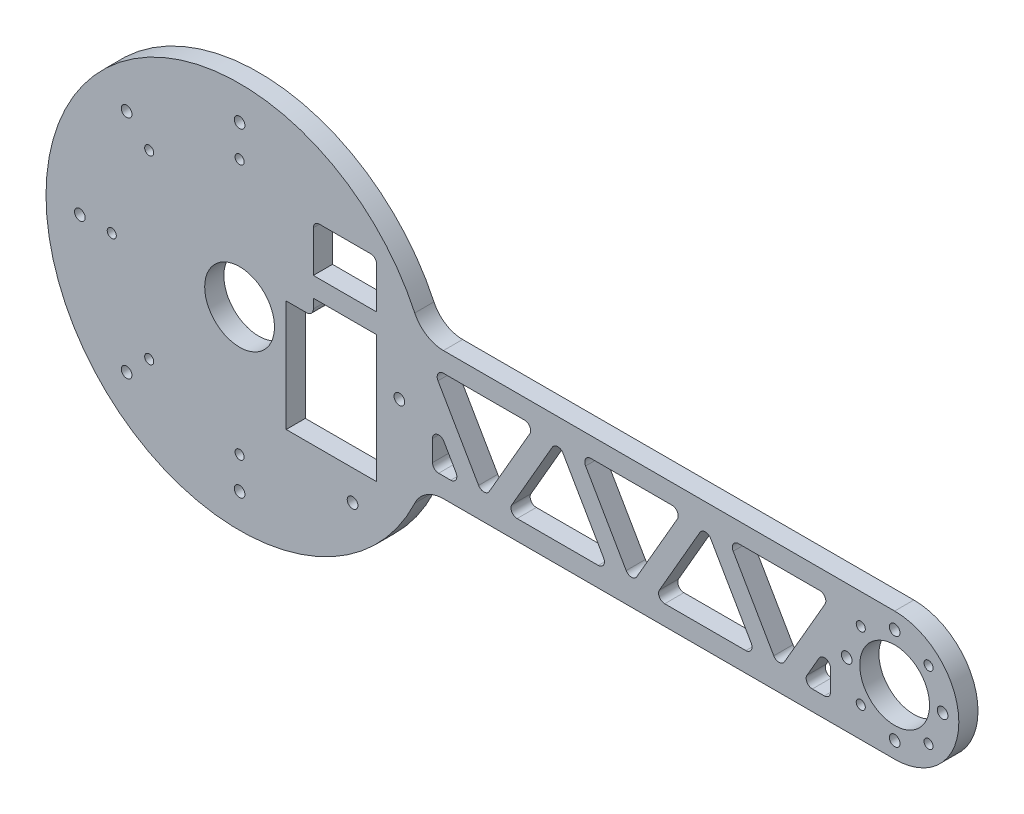
from build123d import *

# Parameters (mm, degrees)
SKETCH1_R              = 11
SKETCH1_R_2            = 1.75
SKETCH1_R_3            = 1.5
BOSS_EXTRUDE1_DEPTH    = 6
SKETCH2_W              = 20
SKETCH2_H              = 15
CUT_EXTRUDE1_DEPTH     = 234.069195734
FILLET1_R              = 2
FILLET2_R              = 10
CUT_EXTRUDE2_DEPTH     = 234.069195734
FILLET3_R              = 2
MOVE_FACE1_OUTLINE_R   = 11
MOVE_FACE1_OUTLINE_R_2 = 10.92
MOVE_FACE1_OUTLINE_R_3 = 1.75
MOVE_FACE1_OUTLINE_R_4 = 1.67
MOVE_FACE1_OUTLINE_R_5 = 1.5
MOVE_FACE1_OUTLINE_R_6 = 1.42
MOVE_FACE1_DEPTH       = 6


# Read off the part's stored shape, not the designer's step: Move Face1
with BuildPart() as part:
    # Sketch1 → Boss-Extrude1 (new body)
    with BuildSketch(Plane.XY):
        with BuildLine():
            Line((57.098598932, -20), (205, -20))
            ThreePointArc((205, -20), (225, 0), (205, 20))
            Line((205, 20), (57.098598932, 20))
            ThreePointArc((57.098598932, 20), (-60.5, 0), (57.098598932, -20))
        make_face()
        Circle(SKETCH1_R, mode=Mode.SUBTRACT)
        with Locations((205, 0)):
            Circle(SKETCH1_R, mode=Mode.SUBTRACT)
        with Locations((205, -15)):
            Circle(SKETCH1_R_2, mode=Mode.SUBTRACT)
        with Locations((215.606601718, -10.606601718)):
            Circle(SKETCH1_R_3, mode=Mode.SUBTRACT)
        with Locations((190, 0)):
            Circle(SKETCH1_R_2, mode=Mode.SUBTRACT)
        with Locations((194.393398282, -10.606601718)):
            Circle(SKETCH1_R_3, mode=Mode.SUBTRACT)
        with Locations((205, 15)):
            Circle(SKETCH1_R_2, mode=Mode.SUBTRACT)
        with Locations((194.393398282, 10.606601718)):
            Circle(SKETCH1_R_3, mode=Mode.SUBTRACT)
        with Locations((220, 0)):
            Circle(SKETCH1_R_2, mode=Mode.SUBTRACT)
        with Locations((215.606601718, 10.606601718)):
            Circle(SKETCH1_R_3, mode=Mode.SUBTRACT)
        with Locations((0, -40)):
            Circle(SKETCH1_R_3, mode=Mode.SUBTRACT)
        with Locations((0, -50)):
            Circle(SKETCH1_R_2, mode=Mode.SUBTRACT)
        with Locations((-28.284271247, -28.284271247)):
            Circle(SKETCH1_R_3, mode=Mode.SUBTRACT)
        with Locations((-35.355339059, -35.355339059)):
            Circle(SKETCH1_R_2, mode=Mode.SUBTRACT)
        with Locations((-40, 0)):
            Circle(SKETCH1_R_3, mode=Mode.SUBTRACT)
        with Locations((-50, 0)):
            Circle(SKETCH1_R_2, mode=Mode.SUBTRACT)
        with Locations((-28.284271247, 28.284271247)):
            Circle(SKETCH1_R_3, mode=Mode.SUBTRACT)
        with Locations((-35.355339059, 35.355339059)):
            Circle(SKETCH1_R_2, mode=Mode.SUBTRACT)
        with Locations((0, 40)):
            Circle(SKETCH1_R_3, mode=Mode.SUBTRACT)
        with Locations((0, 50)):
            Circle(SKETCH1_R_2, mode=Mode.SUBTRACT)
        with Locations((50, 0)):
            Circle(SKETCH1_R_2, mode=Mode.SUBTRACT)
        with Locations((35.355339059, -35.355339059)):
            Circle(SKETCH1_R_2, mode=Mode.SUBTRACT)
    extrude(amount=BOSS_EXTRUDE1_DEPTH)

    # Sketch2 → Cut-Extrude1 (cut, through all)
    with BuildSketch(Plane.XY.offset(6)):
        Polygon((23, 14), (43, 14), (43, -26), (14.5, -26), (14.5, 9), (23, 9), align=None)
        with Locations((33, 27.5)):
            Rectangle(SKETCH2_W, SKETCH2_H)
    extrude(amount=-CUT_EXTRUDE1_DEPTH, mode=Mode.SUBTRACT)

    # Fillet1
    fillet1_edges = [part.edges().sort_by_distance(p)[0] for p in [
        (23, 35, 3),
        (43, 35, 3),
        (23, 9, 3),
    ]]
    fillet(fillet1_edges, radius=FILLET1_R)

    # Fillet2
    fillet2_edges = [part.edges().sort_by_distance(p)[0] for p in [
        (57.098598932, 20, 3),
        (57.098598932, -20, 3),
    ]]
    fillet(fillet2_edges, radius=FILLET2_R)

    # Sketch3 → Cut-Extrude2 (cut, through all)
    with BuildSketch(Plane.XY.offset(6)):
        Polygon((60.292341855, 14), (92.62395693, 14), (76.458149392, -14), align=None)
        Polygon((83.386352623, -14), (99.55216016, 14), (115.717967697, -14), align=None)
        Polygon((106.48036339, 14), (122.646170928, -14), (138.811978465, 14), align=None)
        Polygon((129.574374158, -14), (145.740181695, 14), (161.905989232, -14), align=None)
        Polygon((152.668384925, 14), (168.834192463, -14), (185, 14), align=None)
        Polygon((60.292341855, 2), (60.292341855, -14), (69.529946162, -14), align=None)
        Polygon((185, 2), (185, -14), (175.762395693, -14), align=None)
    extrude(amount=-CUT_EXTRUDE2_DEPTH, mode=Mode.SUBTRACT)

    # Fillet3
    fillet3_edges = [part.edges().sort_by_distance(p)[0] for p in [
        (76.458149392, -14, 3),
        (60.292341855, 14, 3),
        (92.62395693, 14, 3),
        (115.717967697, -14, 3),
        (83.386352623, -14, 3),
        (99.55216016, 14, 3),
        (106.48036339, 14, 3),
        (138.811978465, 14, 3),
        (122.646170928, -14, 3),
        (161.905989232, -14, 3),
        (129.574374158, -14, 3),
        (145.740181695, 14, 3),
        (152.668384925, 14, 3),
        (185, 14, 3),
        (168.834192463, -14, 3),
        (60.292341855, 2, 3),
        (69.529946162, -14, 3),
        (60.292341855, -14, 3),
        (175.762395693, -14, 3),
        (185, 2, 3),
        (185, -14, 3),
    ]]
    fillet(fillet3_edges, radius=FILLET3_R)

    # Move Face1 outline → Move Face1 (add)
    # profile 1 of 32: a face of its own
    with BuildSketch(Plane.XY):
        with BuildLine():
            ThreePointArc((54.82147225, 25.778723404), (-60.58, 0), (54.82147225, -25.778723404))
            ThreePointArc((54.82147225, -25.778723404), (58.481964323, -21.624993617), (63.798510954, -20.08))
            Line((63.798510954, -20.08), (205, -20.08))
            ThreePointArc((205, -20.08), (225.08, 0), (205, 20.08))
            Line((205, 20.08), (63.798510954, 20.08))
            ThreePointArc((63.798510954, 20.08), (58.481964323, 21.624993617), (54.82147225, 25.778723404))
        make_face()
        with BuildLine():
            ThreePointArc((63.798510954, -20), (58.439088947, -21.557453243), (54.749076776, -25.744680851))
            ThreePointArc((54.749076776, -25.744680851), (-60.5, 0), (54.749076776, 25.744680851))
            ThreePointArc((54.749076776, 25.744680851), (58.439088947, 21.557453243), (63.798510954, 20))
            Line((63.798510954, 20), (205, 20))
            ThreePointArc((205, 20), (225, 0), (205, -20))
            Line((205, -20), (63.798510954, -20))
        make_face(mode=Mode.SUBTRACT)
    # profile 2 of 32: a face of its own
    with BuildSketch(Plane.XY):
        with BuildLine():
            Line((23, 33), (23, 20))
            Line((23, 20), (43, 20))
            Line((43, 20), (43, 33))
            ThreePointArc((43, 33), (42.414213562, 34.414213562), (41, 35))
            Line((41, 35), (25, 35))
            ThreePointArc((25, 35), (23.585786438, 34.414213562), (23, 33))
        make_face()
        with BuildLine():
            Line((42.92, 20.08), (23.08, 20.08))
            Line((23.08, 20.08), (23.08, 33))
            ThreePointArc((23.08, 33), (23.64235498, 34.35764502), (25, 34.92))
            Line((25, 34.92), (41, 34.92))
            ThreePointArc((41, 34.92), (42.35764502, 34.35764502), (42.92, 33))
            Line((42.92, 33), (42.92, 20.08))
        make_face(mode=Mode.SUBTRACT)
    # profile 3 of 32: a face of its own
    with BuildSketch(Plane.XY):
        Circle(MOVE_FACE1_OUTLINE_R)
        Circle(MOVE_FACE1_OUTLINE_R_2, mode=Mode.SUBTRACT)
    # profile 4 of 32: a face of its own
    with BuildSketch(Plane.XY):
        with Locations((205, 0)):
            Circle(MOVE_FACE1_OUTLINE_R)
        with Locations((205, 0)):
            Circle(MOVE_FACE1_OUTLINE_R_2, mode=Mode.SUBTRACT)
    # profile 5 of 32: a face of its own
    with BuildSketch(Plane.XY):
        with Locations((205, -15)):
            Circle(MOVE_FACE1_OUTLINE_R_3)
        with Locations((205, -15)):
            Circle(MOVE_FACE1_OUTLINE_R_4, mode=Mode.SUBTRACT)
    # profile 6 of 32: a face of its own
    with BuildSketch(Plane.XY):
        with Locations((215.606601718, -10.606601718)):
            Circle(MOVE_FACE1_OUTLINE_R_5)
        with Locations((215.606601718, -10.606601718)):
            Circle(MOVE_FACE1_OUTLINE_R_6, mode=Mode.SUBTRACT)
    # profile 7 of 32: a face of its own
    with BuildSketch(Plane.XY):
        with Locations((190, 0)):
            Circle(MOVE_FACE1_OUTLINE_R_3)
        with Locations((190, 0)):
            Circle(MOVE_FACE1_OUTLINE_R_4, mode=Mode.SUBTRACT)
    # profile 8 of 32: a face of its own
    with BuildSketch(Plane.XY):
        with Locations((194.393398282, -10.606601718)):
            Circle(MOVE_FACE1_OUTLINE_R_5)
        with Locations((194.393398282, -10.606601718)):
            Circle(MOVE_FACE1_OUTLINE_R_6, mode=Mode.SUBTRACT)
    # profile 9 of 32: a face of its own
    with BuildSketch(Plane.XY):
        with Locations((205, 15)):
            Circle(MOVE_FACE1_OUTLINE_R_3)
        with Locations((205, 15)):
            Circle(MOVE_FACE1_OUTLINE_R_4, mode=Mode.SUBTRACT)
    # profile 10 of 32: a face of its own
    with BuildSketch(Plane.XY):
        with Locations((194.393398282, 10.606601718)):
            Circle(MOVE_FACE1_OUTLINE_R_5)
        with Locations((194.393398282, 10.606601718)):
            Circle(MOVE_FACE1_OUTLINE_R_6, mode=Mode.SUBTRACT)
    # profile 11 of 32: a face of its own
    with BuildSketch(Plane.XY):
        with Locations((220, 0)):
            Circle(MOVE_FACE1_OUTLINE_R_3)
        with Locations((220, 0)):
            Circle(MOVE_FACE1_OUTLINE_R_4, mode=Mode.SUBTRACT)
    # profile 12 of 32: a face of its own
    with BuildSketch(Plane.XY):
        with Locations((215.606601718, 10.606601718)):
            Circle(MOVE_FACE1_OUTLINE_R_5)
        with Locations((215.606601718, 10.606601718)):
            Circle(MOVE_FACE1_OUTLINE_R_6, mode=Mode.SUBTRACT)
    # profile 13 of 32: a face of its own
    with BuildSketch(Plane.XY):
        with Locations((0, -40)):
            Circle(MOVE_FACE1_OUTLINE_R_5)
        with Locations((0, -40)):
            Circle(MOVE_FACE1_OUTLINE_R_6, mode=Mode.SUBTRACT)
    # profile 14 of 32: a face of its own
    with BuildSketch(Plane.XY):
        with Locations((0, -50)):
            Circle(MOVE_FACE1_OUTLINE_R_3)
        with Locations((0, -50)):
            Circle(MOVE_FACE1_OUTLINE_R_4, mode=Mode.SUBTRACT)
    # profile 15 of 32: a face of its own
    with BuildSketch(Plane.XY):
        with Locations((-28.284271247, -28.284271247)):
            Circle(MOVE_FACE1_OUTLINE_R_5)
        with Locations((-28.284271247, -28.284271247)):
            Circle(MOVE_FACE1_OUTLINE_R_6, mode=Mode.SUBTRACT)
    # profile 16 of 32: a face of its own
    with BuildSketch(Plane.XY):
        with Locations((-35.355339059, -35.355339059)):
            Circle(MOVE_FACE1_OUTLINE_R_3)
        with Locations((-35.355339059, -35.355339059)):
            Circle(MOVE_FACE1_OUTLINE_R_4, mode=Mode.SUBTRACT)
    # profile 17 of 32: a face of its own
    with BuildSketch(Plane.XY):
        with Locations((-40, 0)):
            Circle(MOVE_FACE1_OUTLINE_R_5)
        with Locations((-40, 0)):
            Circle(MOVE_FACE1_OUTLINE_R_6, mode=Mode.SUBTRACT)
    # profile 18 of 32: a face of its own
    with BuildSketch(Plane.XY):
        with Locations((-50, 0)):
            Circle(MOVE_FACE1_OUTLINE_R_3)
        with Locations((-50, 0)):
            Circle(MOVE_FACE1_OUTLINE_R_4, mode=Mode.SUBTRACT)
    # profile 19 of 32: a face of its own
    with BuildSketch(Plane.XY):
        with Locations((-28.284271247, 28.284271247)):
            Circle(MOVE_FACE1_OUTLINE_R_5)
        with Locations((-28.284271247, 28.284271247)):
            Circle(MOVE_FACE1_OUTLINE_R_6, mode=Mode.SUBTRACT)
    # profile 20 of 32: a face of its own
    with BuildSketch(Plane.XY):
        with Locations((-35.355339059, 35.355339059)):
            Circle(MOVE_FACE1_OUTLINE_R_3)
        with Locations((-35.355339059, 35.355339059)):
            Circle(MOVE_FACE1_OUTLINE_R_4, mode=Mode.SUBTRACT)
    # profile 21 of 32: a face of its own
    with BuildSketch(Plane.XY):
        with Locations((0, 40)):
            Circle(MOVE_FACE1_OUTLINE_R_5)
        with Locations((0, 40)):
            Circle(MOVE_FACE1_OUTLINE_R_6, mode=Mode.SUBTRACT)
    # profile 22 of 32: a face of its own
    with BuildSketch(Plane.XY):
        with Locations((0, 50)):
            Circle(MOVE_FACE1_OUTLINE_R_3)
        with Locations((0, 50)):
            Circle(MOVE_FACE1_OUTLINE_R_4, mode=Mode.SUBTRACT)
    # profile 23 of 32: a face of its own
    with BuildSketch(Plane.XY):
        with Locations((50, 0)):
            Circle(MOVE_FACE1_OUTLINE_R_3)
        with Locations((50, 0)):
            Circle(MOVE_FACE1_OUTLINE_R_4, mode=Mode.SUBTRACT)
    # profile 24 of 32: a face of its own
    with BuildSketch(Plane.XY):
        with Locations((35.355339059, -35.355339059)):
            Circle(MOVE_FACE1_OUTLINE_R_3)
        with Locations((35.355339059, -35.355339059)):
            Circle(MOVE_FACE1_OUTLINE_R_4, mode=Mode.SUBTRACT)
    # profile 25 of 32: a face of its own
    with BuildSketch(Plane.XY):
        with BuildLine():
            Line((43, 14), (23, 14))
            Line((23, 14), (23, 11))
            ThreePointArc((23, 11), (22.414213562, 9.585786438), (21, 9))
            Line((21, 9), (14.5, 9))
            Line((14.5, 9), (14.5, -26))
            Line((14.5, -26), (43, -26))
            Line((43, -26), (43, 14))
        make_face()
        with BuildLine():
            Line((23.08, 11), (23.08, 13.92))
            Line((23.08, 13.92), (42.92, 13.92))
            Line((42.92, 13.92), (42.92, -25.92))
            Line((42.92, -25.92), (14.58, -25.92))
            Line((14.58, -25.92), (14.58, 8.92))
            Line((14.58, 8.92), (21, 8.92))
            ThreePointArc((21, 8.92), (22.470782105, 9.529217895), (23.08, 11))
        make_face(mode=Mode.SUBTRACT)
    # profile 26 of 32: a face of its own
    with BuildSketch(Plane.XY):
        with BuildLine():
            ThreePointArc((90.891906122, 11), (90.891906122, 13), (89.159855315, 14))
            Line((89.159855315, 14), (63.75644347, 14))
            ThreePointArc((63.75644347, 14), (62.024392663, 13), (62.024392663, 11))
            Line((62.024392663, 11), (74.726098585, -11))
            ThreePointArc((74.726098585, -11), (76.458149392, -12), (78.1902002, -11))
            Line((78.1902002, -11), (90.891906122, 11))
        make_face()
        with BuildLine():
            Line((63.75644347, 13.92), (89.159855315, 13.92))
            ThreePointArc((89.159855315, 13.92), (90.82262409, 12.96), (90.82262409, 11.04))
            Line((90.82262409, 11.04), (78.120918168, -10.96))
            ThreePointArc((78.120918168, -10.96), (76.458149393, -11.92), (74.795380617, -10.96))
            Line((74.795380617, -10.96), (62.093674695, 11.04))
            ThreePointArc((62.093674695, 11.04), (62.093674695, 12.96), (63.75644347, 13.92))
        make_face(mode=Mode.SUBTRACT)
    # profile 27 of 32: a face of its own
    with BuildSketch(Plane.XY):
        with BuildLine():
            ThreePointArc((137.079927657, 11), (137.079927657, 13), (135.34787685, 14))
            Line((135.34787685, 14), (109.944465005, 14))
            ThreePointArc((109.944465005, 14), (108.212414198, 13), (108.212414198, 11))
            Line((108.212414198, 11), (120.91412012, -11))
            ThreePointArc((120.91412012, -11), (122.646170928, -12), (124.378221735, -11))
            Line((124.378221735, -11), (137.079927657, 11))
        make_face()
        with BuildLine():
            Line((109.944465005, 13.92), (135.34787685, 13.92))
            ThreePointArc((135.34787685, 13.92), (137.010645625, 12.96), (137.010645625, 11.04))
            Line((137.010645625, 11.04), (124.308939703, -10.96))
            ThreePointArc((124.308939703, -10.96), (122.646170927, -11.92), (120.983402152, -10.96))
            Line((120.983402152, -10.96), (108.28169623, 11.04))
            ThreePointArc((108.28169623, 11.04), (108.28169623, 12.96), (109.944465005, 13.92))
        make_face(mode=Mode.SUBTRACT)
    # profile 28 of 32: a face of its own
    with BuildSketch(Plane.XY):
        with BuildLine():
            ThreePointArc((183.267949192, 11), (183.267949192, 13), (181.535898385, 14))
            Line((181.535898385, 14), (156.132486541, 14))
            ThreePointArc((156.132486541, 14), (154.400435733, 13), (154.400435733, 11))
            Line((154.400435733, 11), (167.102141655, -11))
            ThreePointArc((167.102141655, -11), (168.834192462, -12), (170.56624327, -11))
            Line((170.56624327, -11), (183.267949192, 11))
        make_face()
        with BuildLine():
            Line((156.132486541, 13.92), (181.535898385, 13.92))
            ThreePointArc((181.535898385, 13.92), (183.19866716, 12.96), (183.19866716, 11.04))
            Line((183.19866716, 11.04), (170.496961238, -10.96))
            ThreePointArc((170.496961238, -10.96), (168.834192462, -11.92), (167.171423687, -10.96))
            Line((167.171423687, -10.96), (154.469717765, 11.04))
            ThreePointArc((154.469717765, 11.04), (154.469717765, 12.96), (156.132486541, 13.92))
        make_face(mode=Mode.SUBTRACT)
    # profile 29 of 32: a face of its own
    with BuildSketch(Plane.XY):
        with BuildLine():
            ThreePointArc((85.11840343, -11), (85.11840343, -13), (86.850454238, -14))
            Line((86.850454238, -14), (112.253866082, -14))
            ThreePointArc((112.253866082, -14), (113.98591689, -13), (113.98591689, -11))
            Line((113.98591689, -11), (101.284210968, 11))
            ThreePointArc((101.284210968, 11), (99.55216016, 12), (97.820109352, 11))
            Line((97.820109352, 11), (85.11840343, -11))
        make_face()
        with BuildLine():
            Line((112.253866082, -13.92), (86.850454238, -13.92))
            ThreePointArc((86.850454238, -13.92), (85.187685462, -12.96), (85.187685462, -11.04))
            Line((85.187685462, -11.04), (97.889391385, 10.96))
            ThreePointArc((97.889391385, 10.96), (99.55216016, 11.92), (101.214928935, 10.96))
            Line((101.214928935, 10.96), (113.916634857, -11.04))
            ThreePointArc((113.916634857, -11.04), (113.916634857, -12.96), (112.253866082, -13.92))
        make_face(mode=Mode.SUBTRACT)
    # profile 30 of 32: a face of its own
    with BuildSketch(Plane.XY):
        with BuildLine():
            ThreePointArc((131.306424965, -11), (131.306424965, -13), (133.038475773, -14))
            Line((133.038475773, -14), (158.441887617, -14))
            ThreePointArc((158.441887617, -14), (160.173938425, -13), (160.173938425, -11))
            Line((160.173938425, -11), (147.472232503, 11))
            ThreePointArc((147.472232503, 11), (145.740181696, 12), (144.008130888, 11))
            Line((144.008130888, 11), (131.306424965, -11))
        make_face()
        with BuildLine():
            Line((158.441887617, -13.92), (133.038475773, -13.92))
            ThreePointArc((133.038475773, -13.92), (131.375706998, -12.96), (131.375706998, -11.04))
            Line((131.375706998, -11.04), (144.07741292, 10.96))
            ThreePointArc((144.07741292, 10.96), (145.740181695, 11.92), (147.40295047, 10.96))
            Line((147.40295047, 10.96), (160.104656393, -11.04))
            ThreePointArc((160.104656393, -11.04), (160.104656393, -12.96), (158.441887617, -13.92))
        make_face(mode=Mode.SUBTRACT)
    # profile 31 of 32: a face of its own
    with BuildSketch(Plane.XY):
        with BuildLine():
            ThreePointArc((60.292341855, -12), (60.878128293, -13.414213562), (62.292341855, -14))
            Line((62.292341855, -14), (66.065844547, -14))
            ThreePointArc((66.065844547, -14), (67.797895355, -13), (67.797895355, -11))
            Line((67.797895355, -11), (64.024392663, -4.464101615))
            ThreePointArc((64.024392663, -4.464101615), (61.774703765, -3.532249963), (60.292341855, -5.464101615))
            Line((60.292341855, -5.464101615), (60.292341855, -12))
        make_face()
        with BuildLine():
            Line((66.065844547, -13.92), (62.292341855, -13.92))
            ThreePointArc((62.292341855, -13.92), (60.934696835, -13.35764502), (60.372341855, -12))
            Line((60.372341855, -12), (60.372341855, -5.464101615))
            ThreePointArc((60.372341855, -5.464101615), (61.795409288, -3.609524029), (63.95511063, -4.504101615))
            Line((63.95511063, -4.504101615), (67.728613322, -11.04))
            ThreePointArc((67.728613322, -11.04), (67.728613322, -12.96), (66.065844547, -13.92))
        make_face(mode=Mode.SUBTRACT)
    # profile 32 of 32: a face of its own
    with BuildSketch(Plane.XY):
        with BuildLine():
            ThreePointArc((177.494446501, -11), (177.494446501, -13), (179.226497308, -14))
            Line((179.226497308, -14), (183, -14))
            ThreePointArc((183, -14), (184.414213562, -13.414213562), (185, -12))
            Line((185, -12), (185, -5.464101615))
            ThreePointArc((185, -5.464101615), (183.51763809, -3.532249963), (181.267949192, -4.464101615))
            Line((181.267949192, -4.464101615), (177.494446501, -11))
        make_face()
        with BuildLine():
            Line((183, -13.92), (179.226497308, -13.92))
            ThreePointArc((179.226497308, -13.92), (177.563728533, -12.96), (177.563728533, -11.04))
            Line((177.563728533, -11.04), (181.337231225, -4.504101615))
            ThreePointArc((181.337231225, -4.504101615), (183.496932567, -3.609524029), (184.92, -5.464101615))
            Line((184.92, -5.464101615), (184.92, -12))
            ThreePointArc((184.92, -12), (184.35764502, -13.35764502), (183, -13.92))
        make_face(mode=Mode.SUBTRACT)
    extrude(amount=MOVE_FACE1_DEPTH)


solid = part.part
